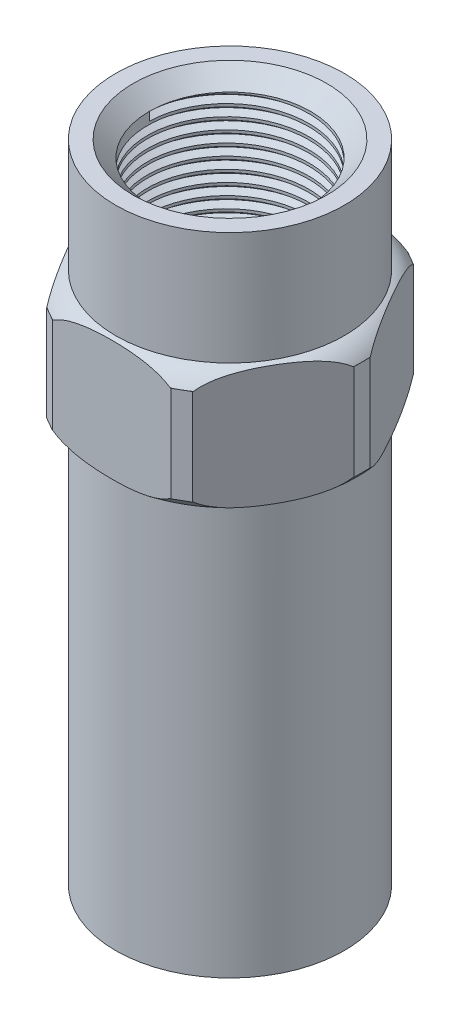
from build123d import *

# Parameters (mm, degrees)
IZIM1_W                     = 10.625
IZIM1_H                     = 38
IZIM1_H_2                   = 11.5
IZIM1_W_2                   = 0.375
IZIM1_H_3                   = 10.5
Y_KSEKLIK_EKSTR_ZYON1_DEPTH = 11.5
PAH1_SIZE                   = 0.85
IZIM4_R                     = 7.5
KES_EKSTR_ZYON1_DEPTH       = 15
IZIM6_R                     = 4.7
KES_EKSTR_ZYON2_DEPTH       = 4
KES_EKSTR_ZYON3_START       = -16
IZIM8_R                     = 7.5
KES_EKSTR_ZYON3_DEPTH       = 16
DI_1_PITCH                  = 1.058333333
DI_2_PITCH                  = 1.058333333


with BuildPart() as part:
    # Çizim1 → Döndür1 (revolve)
    with BuildSketch(Plane.XY, mode=Mode.PRIVATE) as d_nd_r1_sk:
        with Locations((5.3125, -11)):
            Rectangle(IZIM1_W, IZIM1_H)
        with Locations((5.3125, 13.75)):
            Rectangle(IZIM1_W, IZIM1_H_2)
        with Locations((10.8125, 13.75)):
            Rectangle(IZIM1_W_2, IZIM1_H_2)
        with Locations((5.3125, 24.75)):
            Rectangle(IZIM1_W, IZIM1_H_3)
    revolve(d_nd_r1_sk.sketch.rotate(Axis((0, 30, 0), (0, -1, 0)), 90), axis=Axis((0, 30, 0), (0, -1, 0)))

    # Çizim2 → Yükseklik-Ekstrüzyon1 (add)
    with BuildSketch(Plane(origin=(0, 19.5, 0), x_dir=(1, 0, 0), z_dir=(0, 1, 0))):
        with BuildLine():
            Line((-9.52627913, 5.50000054), (-12.701705922, 0))
            Line((-12.701705922, 0), (-9.526279162, -5.500000485))
            ThreePointArc((-9.526279162, -5.500000485), (-11, 3.2e-08), (-9.52627913, 5.50000054))
        make_face()
        with BuildLine():
            Line((-6.350852961, 11), (-9.52627913, 5.50000054))
            ThreePointArc((-9.52627913, 5.50000054), (-5.499999724, 9.526279601), (1.4e-08, 11))
            Line((1.4e-08, 11), (-6.350852961, 11))
        make_face()
        with BuildLine():
            Line((6.350852961, 11), (1.4e-08, 11))
            ThreePointArc((1.4e-08, 11), (5.499999771, 9.526279574), (9.52627917, 5.500000471))
            Line((9.52627917, 5.500000471), (6.350852961, 11))
        make_face()
        with BuildLine():
            ThreePointArc((11, 0), (10.625184011, -2.847009787), (9.526279141, -5.500000521))
            Line((9.526279141, -5.500000521), (12.701705922, 0))
            Line((12.701705922, 0), (9.52627917, 5.500000471))
            ThreePointArc((9.52627917, 5.500000471), (10.625184019, 2.847009759), (11, 0))
        make_face()
        with BuildLine():
            ThreePointArc((9.526279141, -5.500000521), (5.499999686, -9.526279623), (-1.24e-07, -11))
            Line((-1.24e-07, -11), (6.350852961, -11))
            Line((6.350852961, -11), (9.526279141, -5.500000521))
        make_face()
        with BuildLine():
            ThreePointArc((-1.24e-07, -11), (-5.499999811, -9.526279551), (-9.526279162, -5.500000485))
            Line((-9.526279162, -5.500000485), (-6.350852961, -11))
            Line((-6.350852961, -11), (-1.24e-07, -11))
        make_face()
    extrude(amount=-Y_KSEKLIK_EKSTR_ZYON1_DEPTH)

    # Pah1
    pah1_edges = [part.edges().sort_by_distance(p)[0] for p in [
        (-12.701705922, 13.75, 0),
        (-6.350852961, 13.75, -11),
        (6.350852961, 13.75, -11),
        (12.701705922, 13.75, 0),
        (6.350852961, 13.75, 11),
        (-6.350852961, 13.75, 11),
    ]]
    chamfer(pah1_edges, length=PAH1_SIZE)

    # Çizim3 → Kes-Döndür2 (revolve, cut)
    with BuildSketch(Plane.XY):
        with BuildLine():
            Line((-10.625, 19.5), (-10.625, 19.71141139))
            Line((-10.625, 19.71141139), (-12.469852469, 19.71141139))
            Line((-12.469852469, 19.71141139), (-12.469852469, 18.21141139))
            Line((-12.469852469, 18.21141139), (-12.276705922, 18.21141139))
            add(Edge.make_bspline(
                [(-10.625, 19.5), (-11.673308349, 19.118446965), (-12.276705922, 18.21141139)],
                knots=[0, 0, 0, 1, 1, 1], degree=2))
        make_face()
        with BuildLine():
            Line((-12.276705922, 9.311657553), (-12.469852469, 9.311657553))
            Line((-12.469852469, 9.311657553), (-12.469852469, 7.811657553))
            Line((-12.469852469, 7.811657553), (-10.625, 7.811657553))
            Line((-10.625, 7.811657553), (-10.625, 8))
            add(Edge.make_bspline(
                [(-10.625, 8), (-11.673308349, 8.381553035), (-12.276705922, 9.311657553)],
                knots=[0, 0, 0, 1, 1, 1], degree=2))
        make_face()
    revolve(axis=Axis((0, 38.004977738, 0), (0, -1, 0)), mode=Mode.SUBTRACT)

    # Çizim4 → Kes-Ekstrüzyon1 (cut)
    with BuildSketch(Plane.XZ.offset(30)):
        with Locations(Location((0, 0, 0), (0, 0, 270))):
            Circle(IZIM4_R)
    extrude(amount=-KES_EKSTR_ZYON1_DEPTH, mode=Mode.SUBTRACT)

    # Çizim6 → Kes-Ekstrüzyon2 (cut)
    with BuildSketch(Plane.XZ.offset(15)):
        with Locations(Location((0, 0, 0), (0, 0, 270))):
            Circle(IZIM6_R)
    extrude(amount=-KES_EKSTR_ZYON2_DEPTH, mode=Mode.SUBTRACT)

    # Çizim7 → Kes-Döndür3 (revolve, cut)
    with BuildSketch(Plane.XY, mode=Mode.PRIVATE) as kes_d_nd_r3_sk:
        Polygon((-4.7, -14), (-4.7, -15), (-7.5, -15), align=None)
    revolve(kes_d_nd_r3_sk.sketch.rotate(Axis((0, -38.306661486, 0), (0, 1, 0)), 270), axis=Axis((0, -38.306661486, 0), (0, 1, 0)), mode=Mode.SUBTRACT)

    # Çizim8 → Kes-Ekstrüzyon3 (cut)
    with BuildSketch(Plane(origin=(0, 30, 0), x_dir=(1, 0, 0), z_dir=(0, 1, 0)).offset(KES_EKSTR_ZYON3_START)):
        with Locations(Location((0, 0, 0), (0, 0, 90))):
            Circle(IZIM8_R)
    extrude(amount=KES_EKSTR_ZYON3_DEPTH, mode=Mode.SUBTRACT)

    # Çizim16 → Kes-Döndür4 (revolve, cut)
    with BuildSketch(Plane.XY, mode=Mode.PRIVATE) as kes_d_nd_r4_sk:
        Polygon((-7.5, -30), (-7.5, -28.5), (-9, -30), align=None)
        Polygon((-7.5, 30), (-9, 30), (-7.5, 28.5), align=None)
    revolve(kes_d_nd_r4_sk.sketch.rotate(Axis((0, 40.563221165, 0), (0, -1, 0)), 270), axis=Axis((0, 40.563221165, 0), (0, -1, 0)), mode=Mode.SUBTRACT)

    # Diş1: the profile of Diş Profili1 profile screwed along a right-hand helix of 12.992126 turns, 8 arcs to a turn; built about Z, then put on its axis
    di_1_z = Axis((0, 0, 0), (0, 0, 1))
    di_1_corners = [(7.4997, 0, -0.000173205), (8.072839718, 0, 0.330729165), (8.072839718, 0, 0.463020832), (7.4997, 0, 0.793923202)]
    with BuildLine(mode=Mode.PRIVATE) as di_1_profile:
        Line(di_1_corners[0], di_1_corners[1])
        Line(di_1_corners[1], di_1_corners[2])
        Line(di_1_corners[2], di_1_corners[3])
        Line(di_1_corners[3], di_1_corners[0])
    di_1_cap = Face(di_1_profile.wire())
    di_1_turn_angles = [0, 22.5, 45, 67.5, 90, 112.5, 135, 157.5, 180, 202.5, 225, 247.5, 270, 292.5, 315, 337.5, 360]
    di_1_turn_weights = [1, 0.9238795325112867, 1, 0.9238795325112867, 1, 0.9238795325112867, 1, 0.9238795325112867, 1, 0.9238795325112867, 1, 0.9238795325112867, 1, 0.9238795325112867, 1, 0.9238795325112867, 1]
    di_1_turn_rails = [Edge.make_bspline([Vector(p[0], p[1], 0).rotate(di_1_z, di_1_turn_angles[k]) / di_1_turn_weights[k] + Vector(0, 0, p[2] + DI_1_PITCH * di_1_turn_angles[k] / 360) for k in range(17)], [0, 0, 0, 1, 1, 2, 2, 3, 3, 4, 4, 5, 5, 6, 6, 7, 7, 8, 8, 8], 2, di_1_turn_weights) for p in di_1_corners]
    di_1_turn_sides = [Face.make_surface_from_curves(di_1_turn_rails[p[0]], di_1_turn_rails[p[1]]) for p in [(0, 1), (1, 2), (2, 3), (3, 0)]]
    di_1_last_angles = [4320, 4342.5, 4365, 4387.5, 4410, 4432.5, 4455, 4477.5, 4500, 4522.5, 4545, 4567.5, 4590, 4612.5, 4635, 4656.082677165, 4677.165354331]
    di_1_last_weights = [1, 0.9238795325112867, 1, 0.9238795325112867, 1, 0.9238795325112867, 1, 0.9238795325112867, 1, 0.9238795325112867, 1, 0.9238795325112867, 1, 0.9238795325112867, 1, 0.9330623337983811, 1]
    di_1_last_rails = [Edge.make_bspline([Vector(p[0], p[1], 0).rotate(di_1_z, di_1_last_angles[k]) / di_1_last_weights[k] + Vector(0, 0, p[2] + DI_1_PITCH * di_1_last_angles[k] / 360) for k in range(17)], [0, 0, 0, 1, 1, 2, 2, 3, 3, 4, 4, 5, 5, 6, 6, 7, 7, 8, 8, 8], 2, di_1_last_weights) for p in di_1_corners]
    di_1_last_sides = [Face.make_surface_from_curves(di_1_last_rails[p[0]], di_1_last_rails[p[1]]) for p in [(0, 1), (1, 2), (2, 3), (3, 0)]]
    di_1 = Plane(origin=(0, 28.5, 0), x_dir=(-1, 0, 0), z_dir=(0, -1, 0)) * Solid(Shell([*[p.moved(Location((0, 0, DI_1_PITCH * i))) for i in range(12) for p in di_1_turn_sides], *di_1_last_sides, di_1_cap, di_1_cap.rotate(di_1_z, 4677.165354331).moved(Location((0, 0, DI_1_PITCH * 4677.165354331 / 360)))]))
    add(di_1, mode=Mode.SUBTRACT)

    # Diş2: the profile of Diş Profili2 profile screwed along a right-hand helix of 12.283465 turns, 8 arcs to a turn; built about Z, then put on its axis
    di_2_z = Axis((0, 0, 0), (0, 0, 1))
    di_2_corners = [(7.4997, 0, -0.000173205), (8.072839718, 0, 0.330729165), (8.072839718, 0, 0.463020832), (7.4997, 0, 0.793923202)]
    with BuildLine(mode=Mode.PRIVATE) as di_2_profile:
        Line(di_2_corners[0], di_2_corners[1])
        Line(di_2_corners[1], di_2_corners[2])
        Line(di_2_corners[2], di_2_corners[3])
        Line(di_2_corners[3], di_2_corners[0])
    di_2_cap = Face(di_2_profile.wire())
    di_2_turn_angles = [0, 22.5, 45, 67.5, 90, 112.5, 135, 157.5, 180, 202.5, 225, 247.5, 270, 292.5, 315, 337.5, 360]
    di_2_turn_weights = [1, 0.9238795325112867, 1, 0.9238795325112867, 1, 0.9238795325112867, 1, 0.9238795325112867, 1, 0.9238795325112867, 1, 0.9238795325112867, 1, 0.9238795325112867, 1, 0.9238795325112867, 1]
    di_2_turn_rails = [Edge.make_bspline([Vector(p[0], p[1], 0).rotate(di_2_z, di_2_turn_angles[k]) / di_2_turn_weights[k] + Vector(0, 0, p[2] + DI_2_PITCH * di_2_turn_angles[k] / 360) for k in range(17)], [0, 0, 0, 1, 1, 2, 2, 3, 3, 4, 4, 5, 5, 6, 6, 7, 7, 8, 8, 8], 2, di_2_turn_weights) for p in di_2_corners]
    di_2_turn_sides = [Face.make_surface_from_curves(di_2_turn_rails[p[0]], di_2_turn_rails[p[1]]) for p in [(0, 1), (1, 2), (2, 3), (3, 0)]]
    di_2_last_angles = [4320, 4342.5, 4365, 4387.5, 4410, 4416.023622047, 4422.047244094]
    di_2_last_weights = [1, 0.9238795325112867, 1, 0.9238795325112867, 1, 0.994478715590434, 1]
    di_2_last_rails = [Edge.make_bspline([Vector(p[0], p[1], 0).rotate(di_2_z, di_2_last_angles[k]) / di_2_last_weights[k] + Vector(0, 0, p[2] + DI_2_PITCH * di_2_last_angles[k] / 360) for k in range(7)], [0, 0, 0, 1, 1, 2, 2, 3, 3, 3], 2, di_2_last_weights) for p in di_2_corners]
    di_2_last_sides = [Face.make_surface_from_curves(di_2_last_rails[p[0]], di_2_last_rails[p[1]]) for p in [(0, 1), (1, 2), (2, 3), (3, 0)]]
    di_2 = Plane(origin=(0, -28.5, 0), x_dir=(1, 0, 0), z_dir=(0, 1, 0)) * Solid(Shell([*[p.moved(Location((0, 0, DI_2_PITCH * i))) for i in range(12) for p in di_2_turn_sides], *di_2_last_sides, di_2_cap, di_2_cap.rotate(di_2_z, 4422.047244094).moved(Location((0, 0, DI_2_PITCH * 4422.047244094 / 360)))]))
    add(di_2, mode=Mode.SUBTRACT)


solid = part.part
